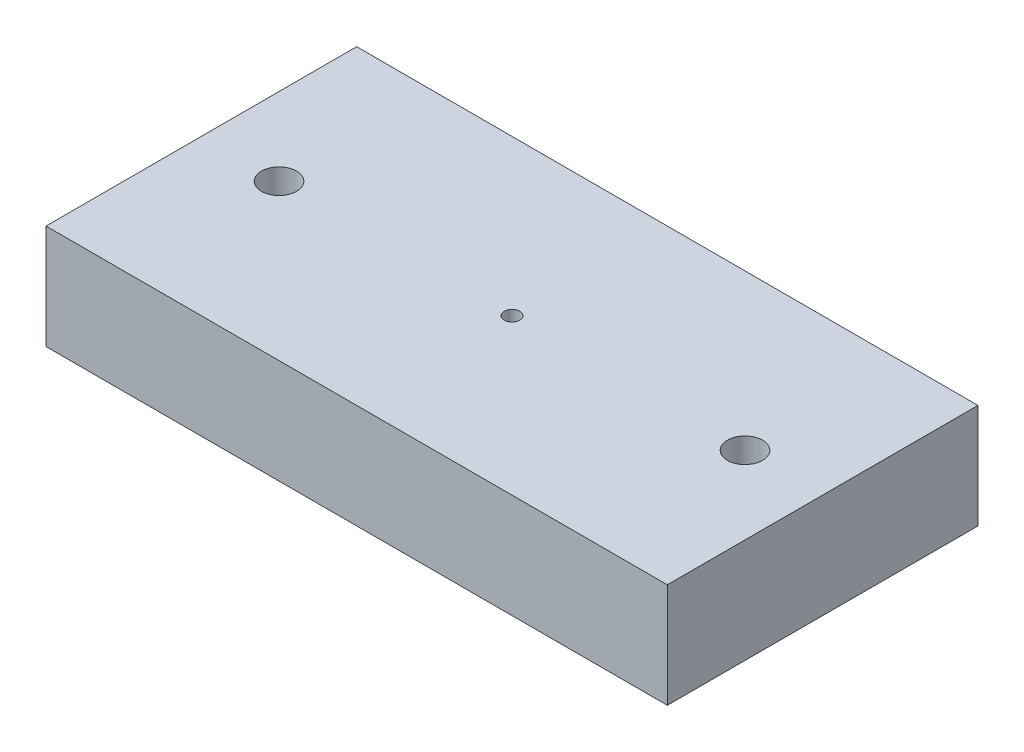
from build123d import *

# Parameters (mm, degrees)
SKETCH1_W           = 40
SKETCH1_H           = 20
BOSS_EXTRUDE1_DEPTH = 6.72
SKETCH2_R           = 0.5
CUT_EXTRUDE1_DEPTH  = 6.72
LPATTERN1_COUNT     = 2
LPATTERN1_PITCH     = 30
SKETCH12_R          = 5.05
SKETCH12_R_2        = 4
CUT_EXTRUDE2_DEPTH  = 4.72
SKETCH13_W          = 5
SKETCH13_H          = 3.5
CUT_EXTRUDE3_DEPTH  = 0.5


with BuildPart() as part:
    # Sketch1 → Boss-Extrude1 (new body)
    with BuildSketch(Plane(origin=(0, 0, 0), x_dir=(1, 0, 0), z_dir=(0, 1, 0))):
        Rectangle(SKETCH1_W, SKETCH1_H)
    extrude(amount=BOSS_EXTRUDE1_DEPTH)

    # Sketch2 → Cut-Extrude1 (cut)
    with BuildSketch(Plane(origin=(0, 6.72, 0), x_dir=(1, 0, 0), z_dir=(0, 1, 0))):
        Circle(SKETCH2_R)
    extrude(amount=-CUT_EXTRUDE1_DEPTH, mode=Mode.SUBTRACT)

    # Sketch9 → #4-40 Tapped Hole1 (revolve, cut)
    with BuildSketch(Plane(origin=(-15, 0, 0), x_dir=(0, 0, -1), z_dir=(1, 0, 0))):
        Polygon((0, 0), (0, 8.279152758), (1.1303, 7.6), (1.1303, 0.635), (1.7653, 0), align=None)
    f_4_40_tapped_hole1 = revolve(axis=Axis((-15, -6.35, 0), (0, 1, 0)), mode=Mode.SUBTRACT)

    # LPattern1: #4-40 Tapped Hole1 ×2
    with Locations(*[(i * LPATTERN1_PITCH, 0, 0) for i in range(1, LPATTERN1_COUNT)]):
        add(f_4_40_tapped_hole1, mode=Mode.SUBTRACT)

    # Sketch12 → Cut-Extrude2 (cut)
    with BuildSketch(Plane.XZ):
        Circle(SKETCH12_R)
        Circle(SKETCH12_R_2, mode=Mode.SUBTRACT)
    extrude(amount=-CUT_EXTRUDE2_DEPTH, mode=Mode.SUBTRACT)

    # Sketch13 → Cut-Extrude3 (cut)
    with BuildSketch(Plane.XZ):
        Rectangle(SKETCH13_W, SKETCH13_H)
    extrude(amount=-CUT_EXTRUDE3_DEPTH, mode=Mode.SUBTRACT)


solid = part.part
